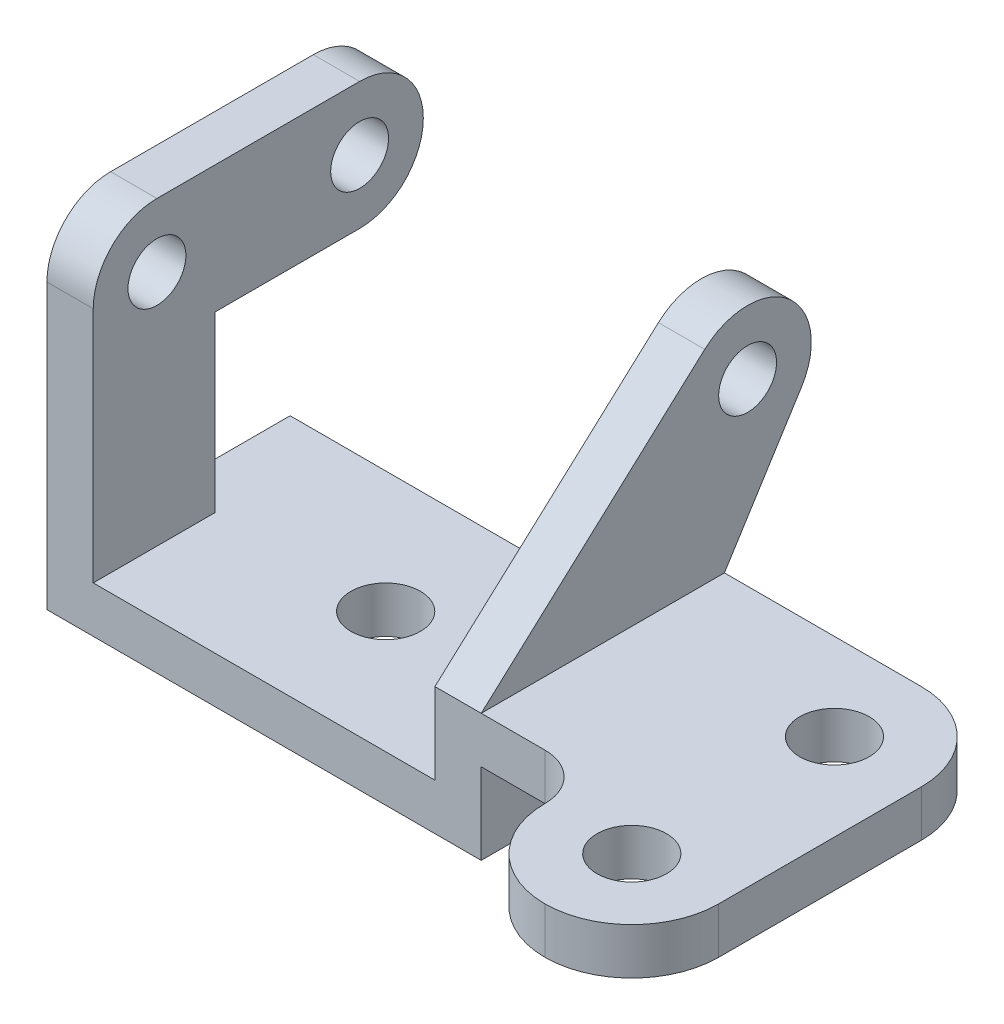
from build123d import *

# Parameters (mm, degrees)
SKETCH1_W           = 150
SKETCH1_H           = 84
SKETCH1_R           = 12
BOSS_EXTRUDE1_DEPTH = 16
SKETCH4_W           = 16
SKETCH4_H           = 84
BOSS_EXTRUDE2_DEPTH = 28
SKETCH5_W           = 84
SKETCH5_H           = 16
BOSS_EXTRUDE3_DEPTH = 98
SKETCH7_W           = 60
SKETCH7_H           = 16
BOSS_EXTRUDE4_DEPTH = 46
FILLET2_R           = 30
FILLET3_R           = 16
CUT_EXTRUDE1_REACH  = 201.02
SKETCH9_R           = 12
SKETCH11_R          = 10
BOSS_EXTRUDE5_DEPTH = 16
SKETCH13_W          = 16
SKETCH13_H          = 42
BOSS_EXTRUDE6_DEPTH = 104
FILLET4_R           = 22
CUT_EXTRUDE2_REACH  = 291.22
SKETCH15_R          = 10
SKETCH14_W          = 16
SKETCH14_H          = 44
BOSS_EXTRUDE8_DEPTH = 72
CUT_EXTRUDE3_REACH  = 291.22
SKETCH16_R          = 10
FILLET5_R           = 22


with BuildPart() as part:
    # Sketch1 → Boss-Extrude1 (new body)
    with BuildSketch(Plane(origin=(0, 0, 0), x_dir=(1, 0, 0), z_dir=(0, 1, 0))):
        Rectangle(SKETCH1_W, SKETCH1_H)
        with Locations(Location((0, 0, 0), (0, 0, 270))):
            Circle(SKETCH1_R, mode=Mode.SUBTRACT)
    extrude(amount=BOSS_EXTRUDE1_DEPTH)

    # Sketch4 → Boss-Extrude2 (add)
    with BuildSketch(Plane(origin=(0, 16, 0), x_dir=(1, 0, 0), z_dir=(0, 1, 0))):
        with Locations((67, 0)):
            Rectangle(SKETCH4_W, SKETCH4_H)
    extrude(amount=BOSS_EXTRUDE2_DEPTH)

    # Sketch5 → Boss-Extrude3 (add)
    with BuildSketch(Plane(origin=(75, 0, 0), x_dir=(0, 0, -1), z_dir=(1, 0, 0))):
        with Locations((0, 36)):
            Rectangle(SKETCH5_W, SKETCH5_H)
    extrude(amount=BOSS_EXTRUDE3_DEPTH)

    # Sketch7 → Boss-Extrude4 (add)
    with BuildSketch(Plane.XY.offset(42)):
        with Locations((143, 36)):
            Rectangle(SKETCH7_W, SKETCH7_H)
    extrude(amount=BOSS_EXTRUDE4_DEPTH)

    # Fillet2
    fillet2_edges = [part.edges().sort_by_distance(p)[0] for p in [
        (173, 36, 88),
        (173, 36, -42),
        (113, 36, 88),
    ]]
    fillet(fillet2_edges, radius=FILLET2_R - 0.0001)  # a hair under: the kernel refuses the full size

    # Fillet3
    fillet3_edges = [part.edges().sort_by_distance(p)[0] for p in [
        (113, 36, 42),
    ]]
    fillet(fillet3_edges, radius=FILLET3_R)

    # Sketch9 → Cut-Extrude1 (cut, up to next)
    with BuildSketch(Plane(origin=(0, 44, 0), x_dir=(1, 0, 0), z_dir=(0, 1, 0)), mode=Mode.PRIVATE) as cut_extrude1_sk1:
        with Locations(Location((143, 12, 0), (0, 0, 270))):
            Circle(SKETCH9_R)
    cut_extrude1_tool1 = extrude(cut_extrude1_sk1.sketch, amount=-CUT_EXTRUDE1_REACH, mode=Mode.PRIVATE) & part.part
    # Sketch9 → Cut-Extrude1 (cut, up to next)
    with BuildSketch(Plane(origin=(0, 44, 0), x_dir=(1, 0, 0), z_dir=(0, 1, 0)), mode=Mode.PRIVATE) as cut_extrude1_sk2:
        with Locations(Location((143, -58, 0), (0, 0, 270))):
            Circle(SKETCH9_R)
    cut_extrude1_tool2 = extrude(cut_extrude1_sk2.sketch, amount=-CUT_EXTRUDE1_REACH, mode=Mode.PRIVATE) & part.part
    add(cut_extrude1_tool1.solids().sort_by_distance((143, 44, -12))[0], mode=Mode.SUBTRACT)
    add(cut_extrude1_tool2.solids().sort_by_distance((143, 44, 58))[0], mode=Mode.SUBTRACT)

    # Sketch11 → Boss-Extrude5 (add)
    with BuildSketch(Plane.ZY.offset(-59)):
        with BuildLine():
            Line((-42, 44), (-68.617604355, 86.278873429))
            ThreePointArc((-68.617604355, 86.278873429), (-64.123788111, 114.867679431), (-35.190151029, 114.268631579))
            Line((-35.190151029, 114.268631579), (42, 44))
            Line((42, 44), (-42, 44))
        make_face()
        with Locations((-50, 98)):
            Circle(SKETCH11_R, mode=Mode.SUBTRACT)
    extrude(amount=-BOSS_EXTRUDE5_DEPTH)

    # Sketch13 → Boss-Extrude6 (add)
    with BuildSketch(Plane(origin=(0, 16, 0), x_dir=(1, 0, 0), z_dir=(0, 1, 0))):
        with Locations((-67, -21)):
            Rectangle(SKETCH13_W, SKETCH13_H)
    extrude(amount=BOSS_EXTRUDE6_DEPTH)

    # Fillet4
    fillet4_edges = [part.edges().sort_by_distance(p)[0] for p in [
        (-67, 120, 42),
    ]]
    fillet(fillet4_edges, radius=FILLET4_R)

    # Sketch15 → Cut-Extrude2 (cut, up to next)
    with BuildSketch(Plane.ZY.offset(75), mode=Mode.PRIVATE) as cut_extrude2_sk1:
        with Locations((20, 98)):
            Circle(SKETCH15_R)
    cut_extrude2_tool1 = extrude(cut_extrude2_sk1.sketch, amount=-CUT_EXTRUDE2_REACH, mode=Mode.PRIVATE) & part.part
    add(cut_extrude2_tool1.solids().sort_by_distance((-75, 98, 20))[0], mode=Mode.SUBTRACT)

    # Sketch14 → Boss-Extrude8 (add)
    with BuildSketch(Plane(origin=(0, 0, 0), x_dir=(-1, 0, 0), z_dir=(0, 0, -1))):
        with Locations((67, 98)):
            Rectangle(SKETCH14_W, SKETCH14_H)
    extrude(amount=BOSS_EXTRUDE8_DEPTH)

    # Sketch16 → Cut-Extrude3 (cut, up to next)
    with BuildSketch(Plane.ZY.offset(75), mode=Mode.PRIVATE) as cut_extrude3_sk1:
        with Locations((-50, 98)):
            Circle(SKETCH16_R)
    cut_extrude3_tool1 = extrude(cut_extrude3_sk1.sketch, amount=-CUT_EXTRUDE3_REACH, mode=Mode.PRIVATE) & part.part
    add(cut_extrude3_tool1.solids().sort_by_distance((-75, 98, -50))[0], mode=Mode.SUBTRACT)

    # Fillet5
    fillet5_edges = [part.edges().sort_by_distance(p)[0] for p in [
        (-67, 120, -72),
        (-67, 76, -72),
    ]]
    fillet(fillet5_edges, radius=FILLET5_R - 0.0001)  # a hair under: the kernel refuses the full size


solid = part.part
